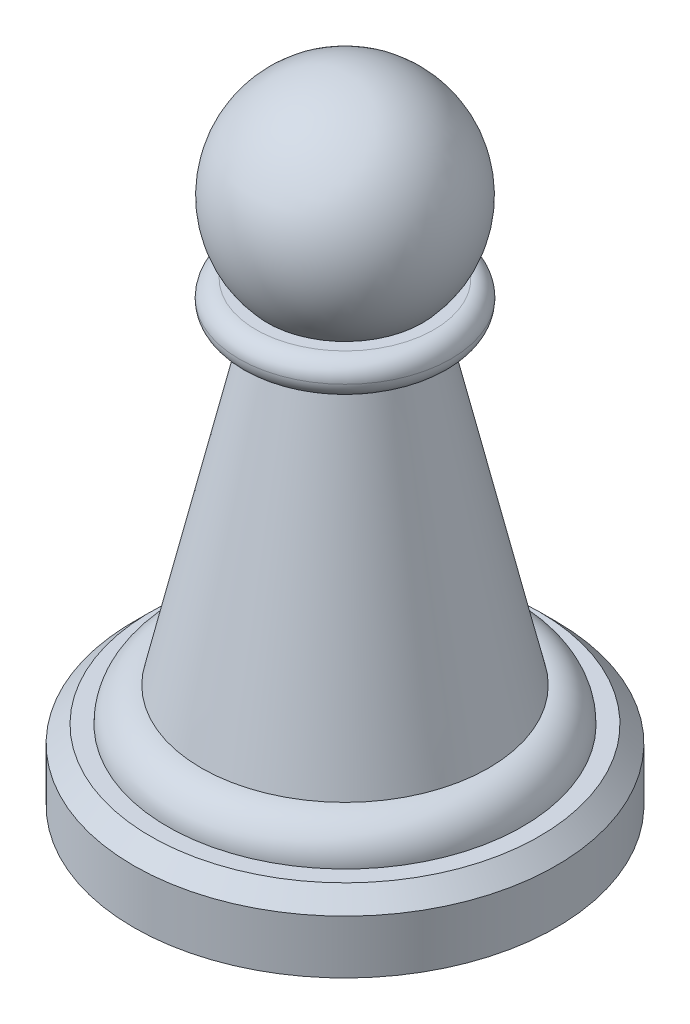
from build123d import *

# Parameters (mm, degrees)
CHAMFER1_SIZE = 0.762
FILLET2_R     = 1.524
FILLET3_R     = 0.762


with BuildPart() as part:
    # Sketch1 → Revolve1 (revolve)
    with BuildSketch(Plane.XY, mode=Mode.PRIVATE) as revolve1_sk:
        with BuildLine():
            Line((0, 0), (-9.525, 0))
            Line((-9.525, 0), (-9.525, 3.175))
            Line((-9.525, 3.175), (-8.001, 3.175))
            Line((-8.001, 3.175), (-8.001, 4.699))
            Line((-8.001, 4.699), (-6.477, 4.699))
            Line((-6.477, 4.699), (-3.175, 19.05))
            Line((-3.175, 19.05), (-4.7752, 19.05))
            Line((-4.7752, 19.05), (-4.7752, 20.574))
            Line((-4.7752, 20.574), (-3.49192268, 20.574))
            ThreePointArc((-3.49192268, 20.574), (-4.364903349, 25.7175), (0, 28.575))
            Line((0, 28.575), (0, 0))
        make_face()
    revolve(revolve1_sk.sketch.rotate(Axis((0, 0, 0), (0, 1, 0)), 270), axis=Axis((0, 0, 0), (0, 1, 0)))

    # Chamfer1
    chamfer1_edges = [part.edges().sort_by_distance(p)[0] for p in [
        (0, 3.175, 9.525),
    ]]
    chamfer(chamfer1_edges, length=CHAMFER1_SIZE)

    # Fillet2
    fillet2_edges = [part.edges().sort_by_distance(p)[0] for p in [
        (0, 4.699, 8.001),
    ]]
    fillet(fillet2_edges, radius=FILLET2_R - 0.0001)  # a hair under: the kernel refuses the full size

    # Fillet3
    fillet3_edges = [part.edges().sort_by_distance(p)[0] for p in [
        (0, 19.05, 4.7752),
        (0, 20.574, 4.7752),
    ]]
    fillet(fillet3_edges, radius=FILLET3_R - 0.0001)  # a hair under: the kernel refuses the full size


solid = part.part
